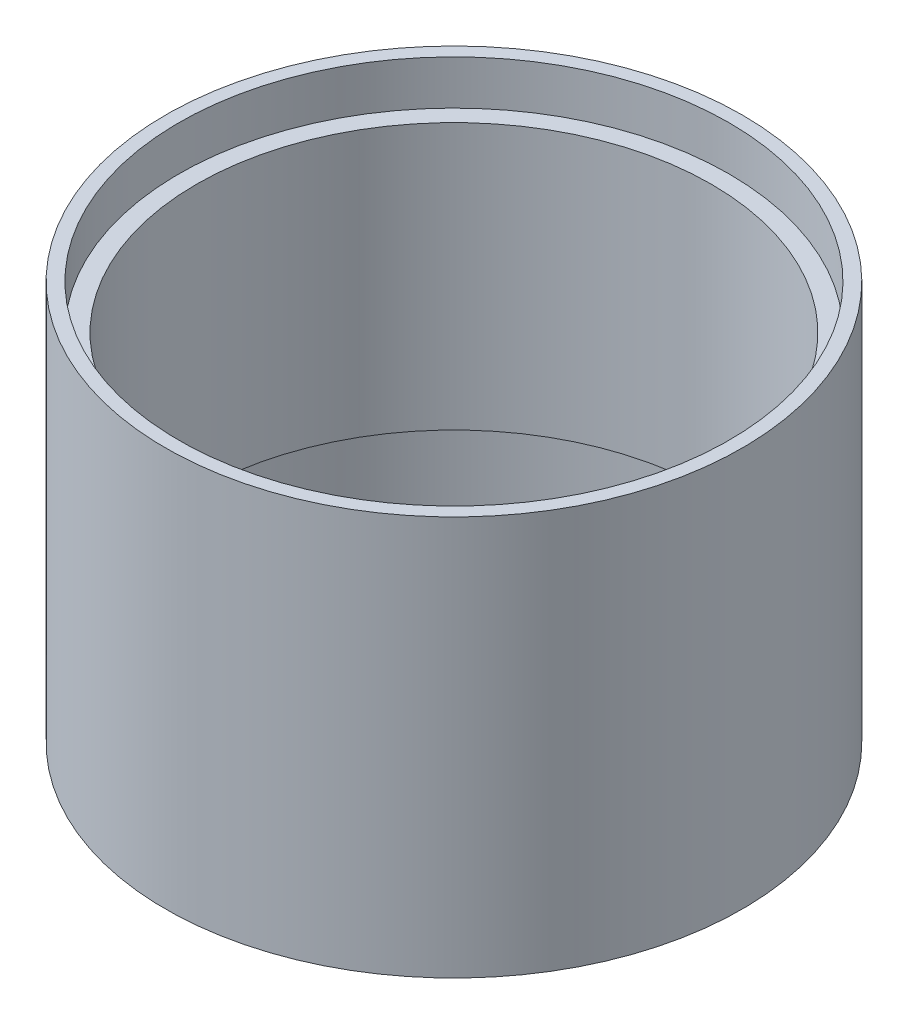
from build123d import *


with BuildPart() as part:
    # Szkic1 → Obrót1 (revolve)
    with BuildSketch(Plane.XY):
        Polygon((-65, 0), (-62, 0), (-62, 20), (-58, 20), (-58, 80), (-62, 80), (-62, 90), (-65, 90), (-65, 20), align=None)
    revolve(axis=Axis((0, 0, 0), (0, 1, 0)))


solid = part.part
